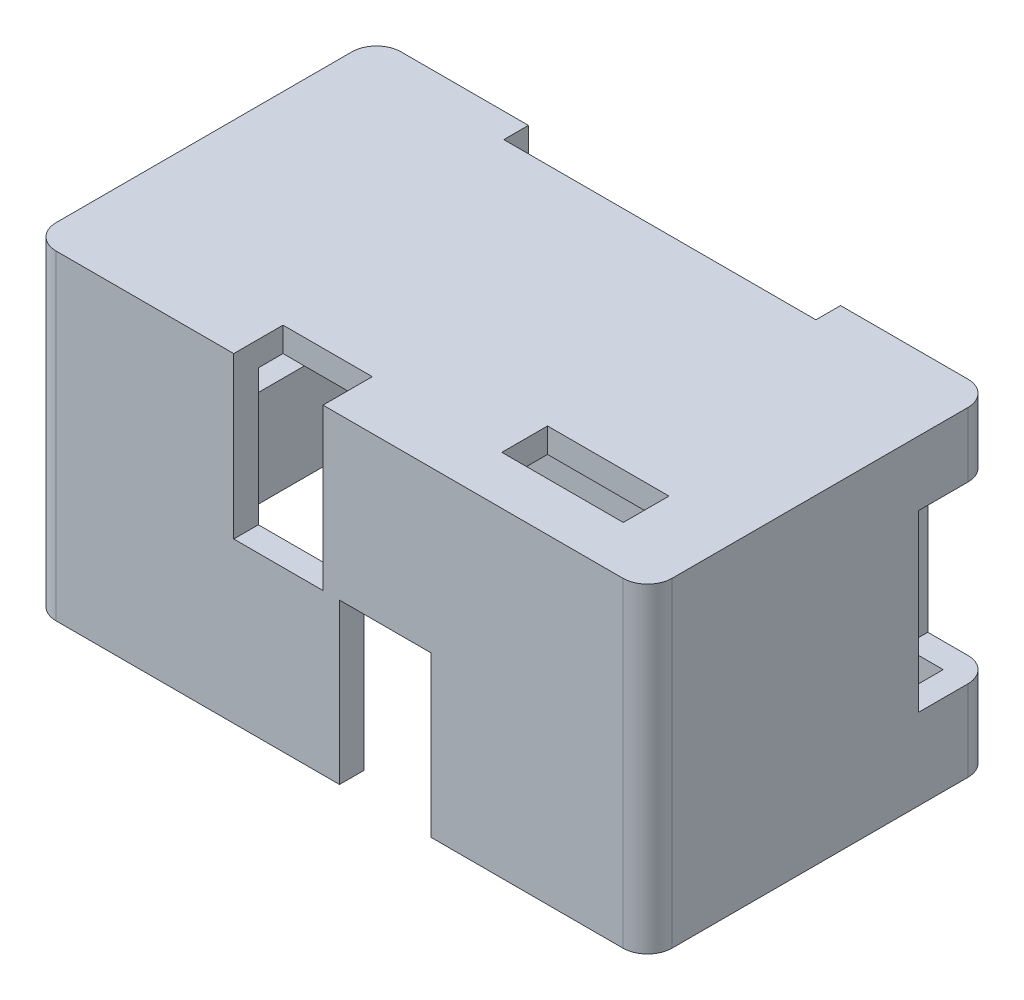
from build123d import *

# Parameters (mm, degrees)
EXTRUDE_5_DEPTH     = 65
SHELL_START         = -21.613486842
SHELL_8_OUTLINE_W   = 115
SHELL_8_OUTLINE_H   = 60
SHELL_8_DEPTH       = 60
SKETCH_7_W          = 18.544828657
SKETCH_7_H          = 32.414144312
CUT_EXTRUDE_1_DEPTH = 10
SKETCH_8_W          = 18.115550217
SKETCH_8_H          = 32.585855688
CUT_EXTRUDE_2_DEPTH = 10
SKETCH_9_W          = 63.329623263
SKETCH_9_H          = 52.442260972
CUT_EXTRUDE_3_DEPTH = 5
SKETCH_10_W         = 13.132979269
SKETCH_10_H         = 35.444448456
CUT_EXTRUDE_4_DEPTH = 15
SKETCH_11_W         = 60
SKETCH_11_H         = 20.052739579
CUT_EXTRUDE_5_DEPTH = 5
SKETCH_12_W         = 24.640582522
SKETCH_12_H         = 9.272414329
CUT_EXTRUDE_6_DEPTH = 5


# Read off the part's stored shape, not the designer's step: 抽壳8
with BuildPart() as part:
    # 草图1<7> → 凸台-拉伸5 (new body)
    with BuildSketch(Plane(origin=(0, 0, 0), x_dir=(1, 0, 0), z_dir=(0, 1, 0))):
        with BuildLine():
            Line((-41.756578947, 26.613486842), (73.243421053, 26.613486842))
            ThreePointArc((73.243421053, 26.613486842), (76.778954959, 25.149020748), (78.243421053, 21.613486842))
            Line((78.243421053, 21.613486842), (78.243421053, -38.386513158))
            ThreePointArc((78.243421053, -38.386513158), (76.778954959, -41.922047064), (73.243421053, -43.386513158))
            Line((73.243421053, -43.386513158), (-41.756578947, -43.386513158))
            ThreePointArc((-41.756578947, -43.386513158), (-45.292112853, -41.922047064), (-46.756578947, -38.386513158))
            Line((-46.756578947, -38.386513158), (-46.756578947, 21.613486842))
            ThreePointArc((-46.756578947, 21.613486842), (-45.292112853, 25.149020748), (-41.756578947, 26.613486842))
        make_face()
    extrude(amount=EXTRUDE_5_DEPTH)

    # 抽壳8 outline → 抽壳8 (cut)
    with BuildSketch(Plane.XY.offset(SHELL_START)):
        with Locations((15.743421053, 30)):
            Rectangle(SHELL_8_OUTLINE_W, SHELL_8_OUTLINE_H)
    extrude(amount=SHELL_8_DEPTH, mode=Mode.SUBTRACT)

    # 草图7 → 切除-拉伸1 (cut)
    with BuildSketch(Plane.XY.offset(43.386513158)):
        with Locations((25.015835382, 16.207072156)):
            Rectangle(SKETCH_7_W, SKETCH_7_H)
    extrude(amount=-CUT_EXTRUDE_1_DEPTH, mode=Mode.SUBTRACT)

    # 草图8 → 切除-拉伸2 (cut)
    with BuildSketch(Plane.XY.offset(43.386513158)):
        with Locations((3.337274103, 48.707072156)):
            Rectangle(SKETCH_8_W, SKETCH_8_H)
    extrude(amount=-CUT_EXTRUDE_2_DEPTH, mode=Mode.SUBTRACT)

    # 草图9 → 切除-拉伸3 (cut)
    with BuildSketch(Plane(origin=(0, 0, -26.613486842), x_dir=(-1, 0, 0), z_dir=(0, 0, -1))):
        with Locations((-15.743421053, 65)):
            Rectangle(SKETCH_9_W, SKETCH_9_H)
    extrude(amount=-CUT_EXTRUDE_3_DEPTH, mode=Mode.SUBTRACT)

    # 草图10 → 切除-拉伸4 (cut)
    with BuildSketch(Plane(origin=(0, 0, -26.613486842), x_dir=(-1, 0, 0), z_dir=(0, 0, -1))):
        with Locations((-71.676931419, 34.167210529)):
            Rectangle(SKETCH_10_W, SKETCH_10_H)
    extrude(amount=-CUT_EXTRUDE_4_DEPTH, mode=Mode.SUBTRACT)

    # 草图11 → 切除-拉伸5 (cut)
    with BuildSketch(Plane.ZY.offset(46.756578947)):
        with Locations((8.386513158, 29.654328955)):
            Rectangle(SKETCH_11_W, SKETCH_11_H)
    extrude(amount=-CUT_EXTRUDE_5_DEPTH, mode=Mode.SUBTRACT)

    # 草图12 → 切除-拉伸6 (cut)
    with BuildSketch(Plane(origin=(0, 65, 0), x_dir=(1, 0, 0), z_dir=(0, 1, 0))):
        with Locations((51.158892447, -28.906022645)):
            Rectangle(SKETCH_12_W, SKETCH_12_H)
    extrude(amount=-CUT_EXTRUDE_6_DEPTH, mode=Mode.SUBTRACT)


solid = part.part
